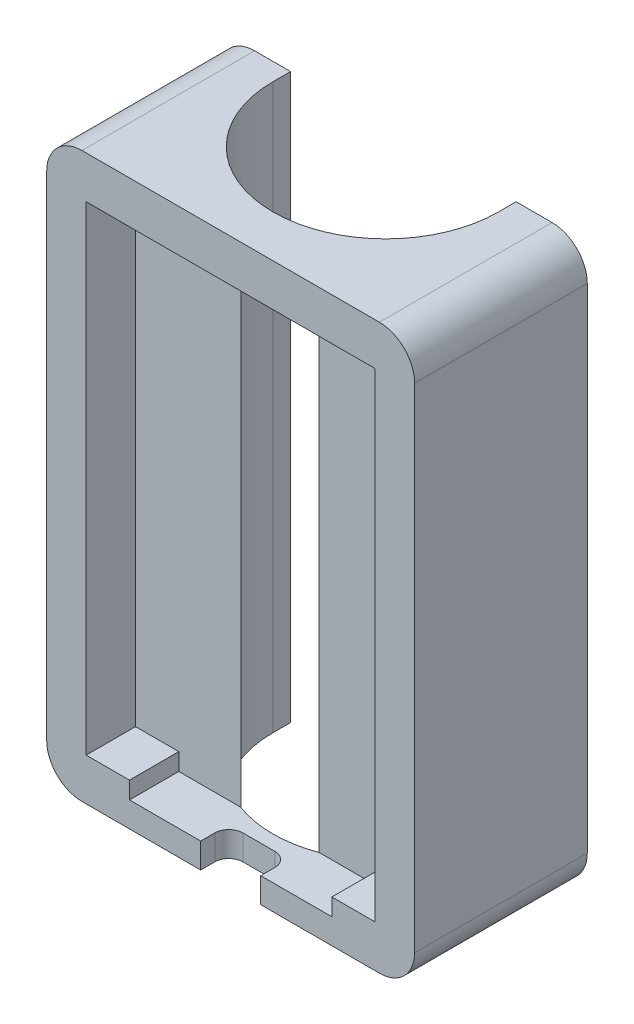
from build123d import *

# Parameters (mm, degrees)
ESQUISSE1_W             = 52.2
ESQUISSE1_H             = 80
BOSS_EXTRU_2_DEPTH      = 22
ESQUISSE3_W             = 48.72
ESQUISSE3_H             = 72.8776
ENL_V_MAT_EXTRU_1_DEPTH = 5
CONG_1_R                = 10
BOSS_EXTRU_4_DEPTH      = 5
ESQUISSE2_R             = 16
ENL_V_MAT_EXTRU_3_DEPTH = 93.647092521
ENL_V_MAT_EXTRU_5_DEPTH = 2
ESQUISSE8_W             = 8.51
ESQUISSE8_H             = 3.5612
ENL_V_MAT_EXTRU_6_DEPTH = 4
CONG_3_R                = 2
ESQUISSE9_W             = 10.1
ESQUISSE9_H             = 80
BOSS_EXTRU_5_DEPTH      = 2.5
CONG_4_R                = 5


with BuildPart() as part:
    # Esquisse1 → Boss.-Extru.2 (new body)
    with BuildSketch(Plane.XY):
        with Locations((-15.124795362, -42.006460905)):
            Rectangle(ESQUISSE1_W, ESQUISSE1_H)
    extrude(amount=BOSS_EXTRU_2_DEPTH)

    # Esquisse3 → Enlèv. mat.-Extru.1 (cut)
    with BuildSketch(Plane.XY.offset(22)):
        with Locations((-15.124795362, -42.006460905)):
            Rectangle(ESQUISSE3_W, ESQUISSE3_H)
    extrude(amount=-ENL_V_MAT_EXTRU_1_DEPTH, mode=Mode.SUBTRACT)

    # Congé1
    cong_1_edges = [part.edges().sort_by_distance(p)[0] for p in [
        (-39.484795362, -78.445260905, 19.5),
        (9.235204638, -78.445260905, 19.5),
        (9.235204638, -5.567660905, 19.5),
        (-39.484795362, -5.567660905, 19.5),
    ]]
    fillet(cong_1_edges, radius=CONG_1_R)

    # Esquisse5 → Boss.-Extru.4 (add)
    with BuildSketch(Plane.XY.offset(17)):
        with BuildLine():
            Line((-35.624795362, -15.567660905), (-35.624795362, -8.006460905))
            Line((-35.624795362, -8.006460905), (-29.484795362, -8.006460905))
            Line((-29.484795362, -8.006460905), (-0.764795362, -8.006460905))
            Line((-0.764795362, -8.006460905), (5.375204638, -8.006460905))
            Line((5.375204638, -8.006460905), (5.375204638, -15.567660905))
            Line((5.375204638, -15.567660905), (5.375204638, -68.445260905))
            Line((5.375204638, -68.445260905), (5.375204638, -76.006460905))
            Line((5.375204638, -76.006460905), (-0.764795362, -76.006460905))
            Line((-0.764795362, -76.006460905), (-0.764795362, -78.445260905))
            ThreePointArc((-0.764795362, -78.445260905), (6.30627245, -75.516328717), (9.235204638, -68.445260905))
            Line((9.235204638, -68.445260905), (9.235204638, -15.567660905))
            ThreePointArc((9.235204638, -15.567660905), (6.30627245, -8.496593093), (-0.764795362, -5.567660905))
            Line((-0.764795362, -5.567660905), (-29.484795362, -5.567660905))
            ThreePointArc((-29.484795362, -5.567660905), (-36.555863174, -8.496593093), (-39.484795362, -15.567660905))
            Line((-39.484795362, -15.567660905), (-39.484795362, -68.445260905))
            ThreePointArc((-39.484795362, -68.445260905), (-36.555863174, -75.516328717), (-29.484795362, -78.445260905))
            Line((-29.484795362, -78.445260905), (-29.484795362, -76.006460905))
            Line((-29.484795362, -76.006460905), (-35.624795362, -76.006460905))
            Line((-35.624795362, -76.006460905), (-35.624795362, -68.445260905))
            Line((-35.624795362, -68.445260905), (-35.624795362, -15.567660905))
        make_face()
    extrude(amount=BOSS_EXTRU_4_DEPTH)

    # Esquisse2 → Enlèv. mat.-Extru.3 (cut, through all)
    with BuildSketch(Plane.XZ.offset(82.006460905)):
        with Locations((-15.124795362, 0)):
            Circle(ESQUISSE2_R)
    extrude(amount=-ENL_V_MAT_EXTRU_3_DEPTH, mode=Mode.SUBTRACT)

    # Esquisse7 → Enlèv. mat.-Extru.5 (cut)
    with BuildSketch(Plane.XY.offset(17)):
        Polygon((-35.624795362, -8.006460905), (5.375204638, -8.006460905), (5.375204638, -76.006460905), (-0.764795362, -76.006460905), (-0.764795362, -78.445260905), (-29.484795362, -78.445260905), (-29.484795362, -76.006460905), (-35.624795362, -76.006460905), align=None)
    extrude(amount=-ENL_V_MAT_EXTRU_5_DEPTH, mode=Mode.SUBTRACT)

    # Esquisse8 → Enlèv. mat.-Extru.6 (cut)
    with BuildSketch(Plane.XY.offset(22)):
        with Locations((-15.124795362, -80.225860905)):
            Rectangle(ESQUISSE8_W, ESQUISSE8_H)
    extrude(amount=-ENL_V_MAT_EXTRU_6_DEPTH, mode=Mode.SUBTRACT)

    # Congé3
    cong_3_edges = [part.edges().sort_by_distance(p)[0] for p in [
        (-10.869795362, -80.225860905, 18),
        (-19.379795362, -80.225860905, 18),
    ]]
    fillet(cong_3_edges, radius=CONG_3_R)

    # Esquisse9 → Boss.-Extru.5 (add)
    with BuildSketch(Plane(origin=(0, 0, 0), x_dir=(-1, 0, 0), z_dir=(0, 0, -1))):
        with Locations((36.174795362, -42.006460905)):
            Rectangle(ESQUISSE9_W, ESQUISSE9_H)
        with Locations((-5.925204638, -42.006460905)):
            Rectangle(ESQUISSE9_W, ESQUISSE9_H)
    extrude(amount=BOSS_EXTRU_5_DEPTH)

    # Congé4
    cong_4_edges = [part.edges().sort_by_distance(p)[0] for p in [
        (10.975204638, -2.006460905, 9.75),
        (10.975204638, -82.006460905, 9.75),
        (-41.224795362, -82.006460905, 9.75),
        (-41.224795362, -2.006460905, 9.75),
    ]]
    fillet(cong_4_edges, radius=CONG_4_R)


solid = part.part
